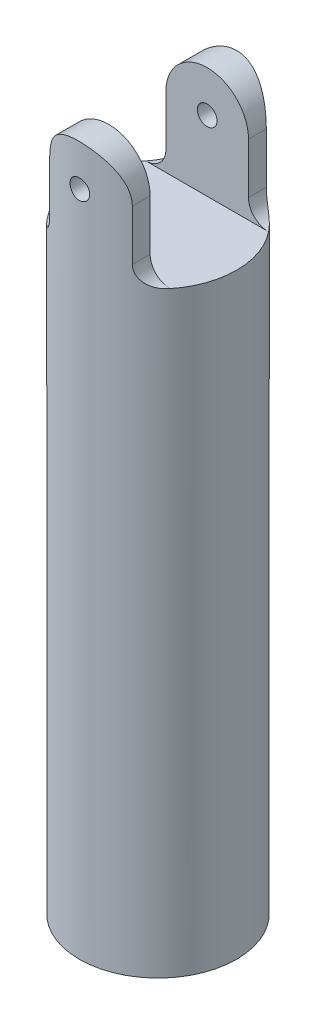
from build123d import *

# Parameters (mm, degrees)
SKETCH1_R               = 6
BOSS_EXTRUDE1_DEPTH     = 12
CUT_EXTRUDE1_DEPTH      = 15.696938457
CUT_EXTRUDE1_DEPTH_BACK = 15.696938457
SKETCH2_W               = 7.5
SKETCH2_H               = 8.5
CUT_EXTRUDE2_DEPTH      = 15.696938457
CUT_EXTRUDE2_DEPTH_BACK = 15.696938457
SKETCH3_R               = 0.75
BOSS_EXTRUDE2_START     = 42
SKETCH4_R               = 6
BOSS_EXTRUDE2_DEPTH     = 42


with BuildPart() as part:
    # Sketch1 → Boss-Extrude1 (new body)
    with BuildSketch(Plane(origin=(0, 0, 0), x_dir=(1, 0, 0), z_dir=(0, 1, 0))):
        Circle(SKETCH1_R)
    extrude(amount=BOSS_EXTRUDE1_DEPTH)

    # Sketch2 → Cut-Extrude1 (cut, two sides: drawn at the far end of the back side and taken through both)
    with BuildSketch(Plane(origin=(0, 0, 0), x_dir=(0, 0, -1), z_dir=(1, 0, 0)).offset(-CUT_EXTRUDE1_DEPTH_BACK)):
        with Locations((0, 7.75)):
            Rectangle(SKETCH2_W, SKETCH2_H)
    extrude(amount=CUT_EXTRUDE1_DEPTH + CUT_EXTRUDE1_DEPTH_BACK, mode=Mode.SUBTRACT)

    # Sketch3 → Cut-Extrude2 (cut, two sides: drawn at the far end of the back side and taken through both)
    with BuildSketch(Plane.XY.offset(-CUT_EXTRUDE2_DEPTH_BACK)):
        with BuildLine():
            Line((4.683748499, 12), (0, 12))
            ThreePointArc((0, 12), (2.227386361, 11.077386361), (3.15, 8.85))
            Line((3.15, 8.85), (3.15, 5))
            ThreePointArc((3.15, 5), (3.589339828, 3.939339828), (4.65, 3.5))
            Line((4.65, 3.5), (4.683748499, 3.5))
            Line((4.683748499, 3.5), (4.683748499, 12))
        make_face()
        with BuildLine():
            Line((-3.15, 5), (-3.15, 8.85))
            ThreePointArc((-3.15, 8.85), (-2.227386361, 11.077386361), (0, 12))
            Line((0, 12), (-4.683748499, 12))
            Line((-4.683748499, 12), (-4.683748499, 3.5))
            Line((-4.683748499, 3.5), (-4.65, 3.5))
            ThreePointArc((-4.65, 3.5), (-3.589339828, 3.939339828), (-3.15, 5))
        make_face()
        with Locations((0, 8.85)):
            Circle(SKETCH3_R)
    extrude(amount=CUT_EXTRUDE2_DEPTH + CUT_EXTRUDE2_DEPTH_BACK, mode=Mode.SUBTRACT)

    # Sketch4 → Boss-Extrude2 (add)
    with BuildSketch(Plane.XZ.offset(BOSS_EXTRUDE2_START)):
        Circle(SKETCH4_R)
        with BuildLine():
            Line((-0.6, 4.207433897), (-0.6, 5))
            Line((-0.6, 5), (0.6, 5))
            Line((0.6, 5), (0.6, 4.207433897))
            ThreePointArc((0.6, 4.207433897), (2.799894973, 3.19735643), (4.091454509, 1.15))
            Line((4.091454509, 1.15), (5, 1.15))
            Line((5, 1.15), (5, -1.15))
            Line((5, -1.15), (4.091454509, -1.15))
            ThreePointArc((4.091454509, -1.15), (2.799894973, -3.19735643), (0.6, -4.207433897))
            Line((0.6, -4.207433897), (0.6, -5))
            Line((0.6, -5), (-0.6, -5))
            Line((-0.6, -5), (-0.6, -4.207433897))
            ThreePointArc((-0.6, -4.207433897), (-2.799894973, -3.19735643), (-4.091454509, -1.15))
            Line((-4.091454509, -1.15), (-5, -1.15))
            Line((-5, -1.15), (-5, 1.15))
            Line((-5, 1.15), (-4.091454509, 1.15))
            ThreePointArc((-4.091454509, 1.15), (-2.799894973, 3.19735643), (-0.6, 4.207433897))
        make_face(mode=Mode.SUBTRACT)
    extrude(amount=-BOSS_EXTRUDE2_DEPTH)


solid = part.part
